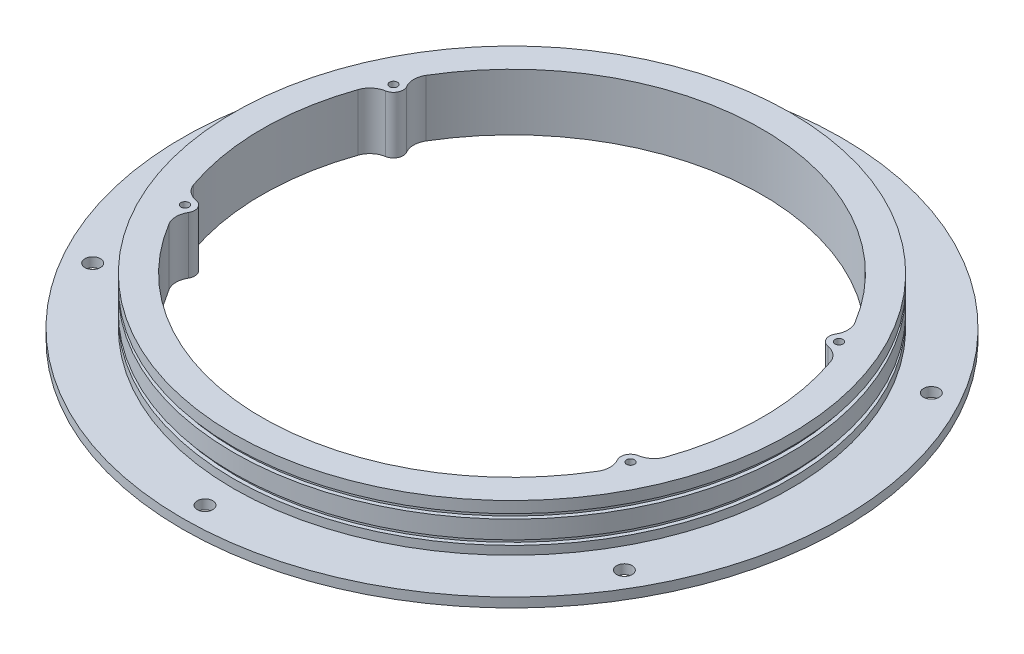
from build123d import *
from build123d.topology import SkipClean

# Parameters (mm, degrees)
SKETCH1_R           = 173.85
SKETCH1_R_2         = 4.1
SKETCH1_R_3         = 131.85
BOSS_EXTRUDE1_DEPTH = 5
SKETCH1_3_R         = 146.85
SKETCH1_3_R_2       = 2.1
BOSS_EXTRUDE2_DEPTH = 30
CUT_EXTRUDE1_START  = 9.5
SKETCH1_4_R         = 146.85
SKETCH1_4_R_2       = 144.85
CUT_EXTRUDE1_DEPTH  = 2.5
CUT_EXTRUDE2_START  = 21.5
SKETCH1_5_R         = 146.85
SKETCH1_5_R_2       = 144.85
CUT_EXTRUDE2_DEPTH  = 2.5


with BuildPart() as part:
    # Sketch1 → Boss-Extrude1 (new body)
    with BuildSketch(Plane(origin=(0, 0, 0), x_dir=(1, 0, 0), z_dir=(0, 1, 0))):
        Circle(SKETCH1_R)
        with Locations((-140.231163508, -80.9625)):
            Circle(SKETCH1_R_2, mode=Mode.SUBTRACT)
        with Locations((0, -161.925)):
            Circle(SKETCH1_R_2, mode=Mode.SUBTRACT)
        with Locations((140.231163508, -80.9625)):
            Circle(SKETCH1_R_2, mode=Mode.SUBTRACT)
        with Locations((-140.231163508, 80.9625)):
            Circle(SKETCH1_R_2, mode=Mode.SUBTRACT)
        with Locations((0, 161.925)):
            Circle(SKETCH1_R_2, mode=Mode.SUBTRACT)
        with Locations((140.231163508, 80.9625)):
            Circle(SKETCH1_R_2, mode=Mode.SUBTRACT)
        Circle(SKETCH1_R_3, mode=Mode.SUBTRACT)
    extrude(amount=BOSS_EXTRUDE1_DEPTH)

    # Sketch1<3> → Boss-Extrude2 (add)
    with BuildSketch(Plane(origin=(0, 0, 0), x_dir=(1, 0, 0), z_dir=(0, 1, 0))):
        Circle(SKETCH1_3_R)
        with BuildLine():
            ThreePointArc((124.505351616, -43.391703343), (121.499509166, -47.753398598), (116.687446985, -49.967790594))
            ThreePointArc((116.687446985, -49.967790594), (112.897087536, -52.838150289), (113.121306631, -57.587415004))
            ThreePointArc((113.121306631, -57.587415004), (114.503744228, -62.700959824), (113.080257044, -67.803229768))
            ThreePointArc((113.080257044, -67.803229768), (0, -131.85), (-113.080257044, -67.803229768))
            ThreePointArc((-113.080257044, -67.803229768), (-114.503744228, -62.700959824), (-113.121306631, -57.587415004))
            ThreePointArc((-113.121306631, -57.587415004), (-112.897087536, -52.838150289), (-116.687446985, -49.967790594))
            ThreePointArc((-116.687446985, -49.967790594), (-121.499509166, -47.753398598), (-124.505351616, -43.391703343))
            ThreePointArc((-124.505351616, -43.391703343), (-131.85, 0), (-124.505351616, 43.391703343))
            ThreePointArc((-124.505351616, 43.391703343), (-121.499509166, 47.753398598), (-116.687446985, 49.967790594))
            ThreePointArc((-116.687446985, 49.967790594), (-112.897087536, 52.838150289), (-113.121306631, 57.587415004))
            ThreePointArc((-113.121306631, 57.587415004), (-114.503744228, 62.700959824), (-113.080257044, 67.803229768))
            ThreePointArc((-113.080257044, 67.803229768), (0, 131.85), (113.080257044, 67.803229768))
            ThreePointArc((113.080257044, 67.803229768), (114.503744228, 62.700959824), (113.121306631, 57.587415004))
            ThreePointArc((113.121306631, 57.587415004), (112.897087536, 52.838150289), (116.687446985, 49.967790594))
            ThreePointArc((116.687446985, 49.967790594), (121.499509166, 47.753398598), (124.505351616, 43.391703343))
            ThreePointArc((124.505351616, 43.391703343), (131.85, 0), (124.505351616, -43.391703343))
        make_face(mode=Mode.SUBTRACT)
        with Locations((117.516222284, 55)):
            Circle(SKETCH1_3_R_2, mode=Mode.SUBTRACT)
        with Locations((-117.516222284, 55)):
            Circle(SKETCH1_3_R_2, mode=Mode.SUBTRACT)
        with Locations((-117.516222284, -55)):
            Circle(SKETCH1_3_R_2, mode=Mode.SUBTRACT)
        with Locations((117.516222284, -55)):
            Circle(SKETCH1_3_R_2, mode=Mode.SUBTRACT)
    extrude(amount=BOSS_EXTRUDE2_DEPTH)

    # Sketch1<4> → Cut-Extrude1 (cut)
    with SkipClean():  # the faces are left unmerged after this step: merging them gives an invalid solid
        with BuildSketch(Plane(origin=(0, 0, 0), x_dir=(1, 0, 0), z_dir=(0, 1, 0)).offset(CUT_EXTRUDE1_START)):
            Circle(SKETCH1_4_R)
            Circle(SKETCH1_4_R_2, mode=Mode.SUBTRACT)
        extrude(amount=CUT_EXTRUDE1_DEPTH, mode=Mode.SUBTRACT)

    # Sketch1<5> → Cut-Extrude2 (cut)
    with SkipClean():  # the faces are left unmerged after this step: merging them gives an invalid solid
        with BuildSketch(Plane(origin=(0, 0, 0), x_dir=(1, 0, 0), z_dir=(0, 1, 0)).offset(CUT_EXTRUDE2_START)):
            Circle(SKETCH1_5_R)
            Circle(SKETCH1_5_R_2, mode=Mode.SUBTRACT)
        extrude(amount=CUT_EXTRUDE2_DEPTH, mode=Mode.SUBTRACT)


solid = part.part
